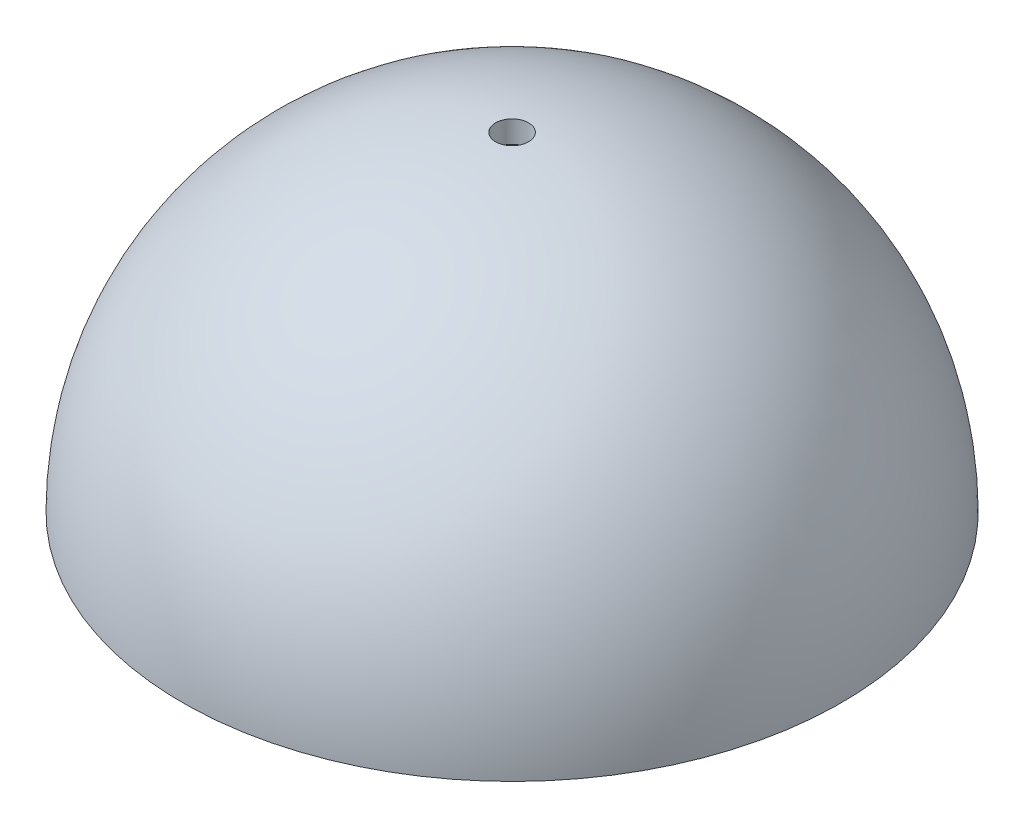
from build123d import *

# Parameters (mm, degrees)
SHELL1_T                = -10
CUT_EXTRUDE3_DEPTH      = 260.807621135
CUT_EXTRUDE3_DEPTH_BACK = 260.807621135
SKETCH2_R               = 7.5


with BuildPart() as part:
    # Sketch1 → Revolve1 (revolve)
    with BuildSketch(Plane.XY):
        with BuildLine():
            Line((0, 0), (0, 150))
            ThreePointArc((0, 150), (-106.066017178, 106.066017178), (-150, 0))
            Line((-150, 0), (0, 0))
        make_face()
    revolve(axis=Axis((0, 0, 0), (0, 1, 0)))

    # Shell1
    shell1_openings = [part.faces().sort_by_distance(p)[0] for p in [
        (0, 0, 0),
    ]]
    offset(amount=SHELL1_T, openings=shell1_openings, kind=Kind.INTERSECTION)

    # Sketch2 → Cut-Extrude3 (cut, two sides: drawn at the far end of the back side and taken through both)
    with BuildSketch(Plane(origin=(0, 0, 0), x_dir=(1, 0, 0), z_dir=(0, 1, 0)).offset(-CUT_EXTRUDE3_DEPTH_BACK)):
        Circle(SKETCH2_R)
    extrude(amount=CUT_EXTRUDE3_DEPTH + CUT_EXTRUDE3_DEPTH_BACK, mode=Mode.SUBTRACT)


solid = part.part
